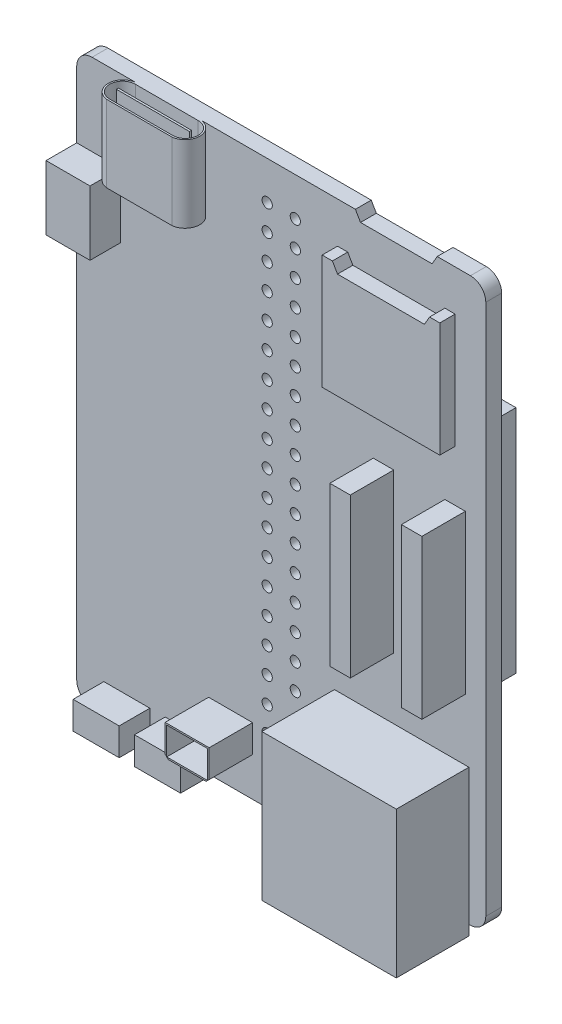
from build123d import *

# Parameters (mm, degrees)
SKETCH1_W            = 55
SKETCH1_H            = 40
BOSS_EXTRUDE1_DEPTH  = 1.55
FILLET1_R            = 1.5
SKETCH2_W            = 13.15
SKETCH2_H            = 14.3
BOSS_EXTRUDE2_DEPTH  = 7.1
SKETCH3_W            = 12.5
SKETCH3_H            = 6.5
SKETCH3_W_2          = 11.1
SKETCH3_H_2          = 1.497681088
CUT_EXTRUDE1_DEPTH   = 13.3
SKETCH4_W            = 8.95
SKETCH4_H            = 7.5
BOSS_EXTRUDE3_DEPTH  = 2.85
CUT_EXTRUDE2_DEPTH   = 7.5
SKETCH5_3_W          = 7.15
SKETCH5_3_H          = 0.2
CUT_EXTRUDE3_DEPTH   = 7
BOSS_EXTRUDE4_DEPTH  = 1.5
CUT_EXTRUDE4_DEPTH   = 10
SKETCH8_W            = 4.5
SKETCH8_H            = 2.7
BOSS_EXTRUDE5_DEPTH  = 3
SKETCH9_R            = 1
BOSS_EXTRUDE6_DEPTH  = 0.5
SKETCH10_W           = 2
SKETCH10_H           = 15.5
BOSS_EXTRUDE7_DEPTH  = 4.25
SKETCH8_4_W          = 4.3
SKETCH8_4_H          = 3
BOSS_EXTRUDE9_DEPTH  = 4.25
SHELL2_T             = -0.15
CHAMFER1_SIZE        = 0.3
SKETCH11_R           = 0.5
CUT_EXTRUDE5_DEPTH   = 1.55
SKETCH12_W           = 4.3
SKETCH12_H           = 6.3
BOSS_EXTRUDE10_DEPTH = 3
SHELL3_T             = -0.2
SKETCH13_W           = 2.9
SKETCH13_H           = 22.5
BOSS_EXTRUDE11_DEPTH = 3


with BuildPart() as part:
    # Sketch1 → Boss-Extrude1 (new body)
    with BuildSketch(Plane(origin=(0, 0, 0), x_dir=(0, 1, 0), z_dir=(0, 0, 1))):
        Rectangle(SKETCH1_W, SKETCH1_H)
    extrude(amount=BOSS_EXTRUDE1_DEPTH)

    # Fillet1
    fillet1_edges = [part.edges().sort_by_distance(p)[0] for p in [
        (20, 27.5, 0.775),
        (20, -27.5, 0.775),
        (-20, -27.5, 0.775),
        (-20, 27.5, 0.775),
    ]]
    fillet(fillet1_edges, radius=FILLET1_R)

    # Sketch2 → Boss-Extrude2 (add)
    with BuildSketch(Plane.XY.offset(1.55)):
        with Locations((11.775, -21.35)):
            Rectangle(SKETCH2_W, SKETCH2_H)
    extrude(amount=BOSS_EXTRUDE2_DEPTH)

    # Sketch3 → Cut-Extrude1 (cut)
    with BuildSketch(Plane.XZ.offset(28.5)):
        with Locations((11.775, 5.1)):
            Rectangle(SKETCH3_W, SKETCH3_H)
        with Locations((11.775, 6.101159456)):
            Rectangle(SKETCH3_W_2, SKETCH3_H_2, mode=Mode.SUBTRACT)
    extrude(amount=-CUT_EXTRUDE1_DEPTH, mode=Mode.SUBTRACT)

    # Sketch4 → Boss-Extrude3 (add)
    with BuildSketch(Plane.XY.offset(1.55)):
        with Locations((-11.025, 23.75)):
            Rectangle(SKETCH4_W, SKETCH4_H)
    extrude(amount=BOSS_EXTRUDE3_DEPTH)

    # Sketch5 → Cut-Extrude2 (cut)
    with BuildSketch(Plane(origin=(0, 27.5, 0), x_dir=(-1, 0, 0), z_dir=(0, 1, 0))):
        with BuildLine():
            Line((6.55, 4.4), (6.55, 2.975))
            ThreePointArc((6.55, 2.975), (6.910359128, 3.926260685), (7.810540583, 4.4))
            Line((7.810540583, 4.4), (6.55, 4.4))
        make_face()
        with BuildLine():
            Line((6.55, 1.55), (7.810540583, 1.55))
            ThreePointArc((7.810540583, 1.55), (6.910359128, 2.023739315), (6.55, 2.975))
            Line((6.55, 2.975), (6.55, 1.55))
        make_face()
        with BuildLine():
            Line((15.5, 1.55), (15.5, 2.975))
            ThreePointArc((15.5, 2.975), (15.139640872, 2.023739315), (14.239459417, 1.55))
            Line((14.239459417, 1.55), (15.5, 1.55))
        make_face()
        with BuildLine():
            Line((15.5, 4.4), (14.239459417, 4.4))
            ThreePointArc((14.239459417, 4.4), (15.139640872, 3.926260685), (15.5, 2.975))
            Line((15.5, 2.975), (15.5, 4.4))
        make_face()
    extrude(amount=-CUT_EXTRUDE2_DEPTH, mode=Mode.SUBTRACT)

    # Sketch5<3> → Cut-Extrude3 (cut)
    with BuildSketch(Plane(origin=(0, 27.5, 0), x_dir=(-1, 0, 0), z_dir=(0, 1, 0))):
        with BuildLine():
            Line((7.95, 1.719461162), (14.1, 1.719461162))
            ThreePointArc((14.1, 1.719461162), (15.355538838, 2.975), (14.1, 4.230538838))
            Line((14.1, 4.230538838), (7.95, 4.230538838))
            ThreePointArc((7.95, 4.230538838), (6.694461162, 2.975), (7.95, 1.719461162))
        make_face()
        with Locations((11.025, 2.975)):
            Rectangle(SKETCH5_3_W, SKETCH5_3_H, mode=Mode.SUBTRACT)
    extrude(amount=-CUT_EXTRUDE3_DEPTH, mode=Mode.SUBTRACT)

    # Sketch6 → Boss-Extrude4 (add)
    with BuildSketch(Plane.XY.offset(1.55)):
        Polygon((16, 23.5), (15.5, 22.633974596), (7, 22.633974596), (6.5, 23.5), (5.5, 23.5), (5.5, 12.3), (17, 12.3), (17, 23.5), align=None)
    extrude(amount=BOSS_EXTRUDE4_DEPTH)

    # Sketch7 → Cut-Extrude4 (cut)
    with BuildSketch(Plane.XY.offset(1.55)):
        Polygon((7.25, 27.5), (7.75, 26.633974596), (14.75, 26.633974596), (15.25, 27.5), align=None)
    extrude(amount=-CUT_EXTRUDE4_DEPTH, mode=Mode.SUBTRACT)

    # Sketch8 → Boss-Extrude5 (add)
    with BuildSketch(Plane.XY.offset(1.55)):
        with Locations((-9.1, -26.15)):
            Rectangle(SKETCH8_W, SKETCH8_H)
        with Locations((-15.1, -26.15)):
            Rectangle(SKETCH8_W, SKETCH8_H)
    extrude(amount=BOSS_EXTRUDE5_DEPTH)

    # Sketch9 → Boss-Extrude6 (add)
    with BuildSketch(Plane.XZ.offset(27.5)):
        with Locations(Location((-9.1, 3.05, 0), (0, 0, 270))):
            Circle(SKETCH9_R)
        with Locations(Location((-15.1, 3.05, 0), (0, 0, 90))):
            Circle(SKETCH9_R)
    extrude(amount=BOSS_EXTRUDE6_DEPTH)

    # Sketch10 → Boss-Extrude7 (add)
    with BuildSketch(Plane.XY.offset(1.55)):
        with Locations((17, -0.45)):
            Rectangle(SKETCH10_W, SKETCH10_H)
        with Locations((10, -0.45)):
            Rectangle(SKETCH10_W, SKETCH10_H)
    extrude(amount=BOSS_EXTRUDE7_DEPTH)


with BuildPart() as body_2:
    # Sketch8<4> → Boss-Extrude9 (new body)
    with BuildSketch(Plane.XY.offset(1.55)):
        with Locations((-4.95, -22.5)):
            Rectangle(SKETCH8_4_W, SKETCH8_4_H)
    extrude(amount=BOSS_EXTRUDE9_DEPTH)

    # Shell2
    shell2_openings = [body_2.faces().sort_by_distance(p)[0] for p in [
        (-4.95, -22.5, 5.8),
    ]]
    offset(amount=SHELL2_T, openings=shell2_openings, kind=Kind.INTERSECTION)


with BuildPart() as part_1:
    add(part.part)

    # Combine1: union body 2
    add(body_2.part)

    # Chamfer1
    chamfer1_edges = [part_1.edges().sort_by_distance(p)[0] for p in [
        (-2.8, -24, 3.675),
        (-7.1, -24, 3.675),
    ]]
    chamfer(chamfer1_edges, length=CHAMFER1_SIZE - 0.0001)  # a hair under: the kernel refuses the full size

    # Sketch11 → Cut-Extrude5 (cut)
    with BuildSketch(Plane.XY.offset(1.55)):
        with Locations((1.375, 23.75)):
            Circle(SKETCH11_R)
        with Locations((1.375, 21.25)):
            Circle(SKETCH11_R)
        with Locations((1.375, 18.75)):
            Circle(SKETCH11_R)
        with Locations((1.375, 16.25)):
            Circle(SKETCH11_R)
        with Locations((1.375, 13.75)):
            Circle(SKETCH11_R)
        with Locations((1.375, 11.25)):
            Circle(SKETCH11_R)
        with Locations((1.375, 8.75)):
            Circle(SKETCH11_R)
        with Locations((1.375, 6.25)):
            Circle(SKETCH11_R)
        with Locations((1.375, 3.75)):
            Circle(SKETCH11_R)
        with Locations((1.375, 1.25)):
            Circle(SKETCH11_R)
        with Locations((1.375, -1.25)):
            Circle(SKETCH11_R)
        with Locations((1.375, -3.75)):
            Circle(SKETCH11_R)
        with Locations((1.375, -6.25)):
            Circle(SKETCH11_R)
        with Locations((1.375, -8.75)):
            Circle(SKETCH11_R)
        with Locations((1.375, -11.25)):
            Circle(SKETCH11_R)
        with Locations((1.375, -13.75)):
            Circle(SKETCH11_R)
        with Locations((1.375, -16.25)):
            Circle(SKETCH11_R)
        with Locations((1.375, -18.75)):
            Circle(SKETCH11_R)
        with Locations((1.375, -21.25)):
            Circle(SKETCH11_R)
        with Locations((1.375, -23.75)):
            Circle(SKETCH11_R)
        with Locations(Location((-1.375, -23.75, 0), (0, 0, 180))):
            Circle(SKETCH11_R)
        with Locations(Location((-1.375, -21.25, 0), (0, 0, 180))):
            Circle(SKETCH11_R)
        with Locations(Location((-1.375, -18.75, 0), (0, 0, 180))):
            Circle(SKETCH11_R)
        with Locations(Location((-1.375, -16.25, 0), (0, 0, 180))):
            Circle(SKETCH11_R)
        with Locations(Location((-1.375, -13.75, 0), (0, 0, 180))):
            Circle(SKETCH11_R)
        with Locations(Location((-1.375, -11.25, 0), (0, 0, 180))):
            Circle(SKETCH11_R)
        with Locations(Location((-1.375, -8.75, 0), (0, 0, 180))):
            Circle(SKETCH11_R)
        with Locations(Location((-1.375, -6.25, 0), (0, 0, 180))):
            Circle(SKETCH11_R)
        with Locations(Location((-1.375, -3.75, 0), (0, 0, 180))):
            Circle(SKETCH11_R)
        with Locations(Location((-1.375, -1.25, 0), (0, 0, 180))):
            Circle(SKETCH11_R)
        with Locations(Location((-1.375, 1.25, 0), (0, 0, 180))):
            Circle(SKETCH11_R)
        with Locations(Location((-1.375, 3.75, 0), (0, 0, 180))):
            Circle(SKETCH11_R)
        with Locations(Location((-1.375, 6.25, 0), (0, 0, 180))):
            Circle(SKETCH11_R)
        with Locations(Location((-1.375, 8.75, 0), (0, 0, 180))):
            Circle(SKETCH11_R)
        with Locations(Location((-1.375, 11.25, 0), (0, 0, 180))):
            Circle(SKETCH11_R)
        with Locations(Location((-1.375, 13.75, 0), (0, 0, 180))):
            Circle(SKETCH11_R)
        with Locations(Location((-1.375, 16.25, 0), (0, 0, 180))):
            Circle(SKETCH11_R)
        with Locations(Location((-1.375, 18.75, 0), (0, 0, 180))):
            Circle(SKETCH11_R)
        with Locations(Location((-1.375, 23.75, 0), (0, 0, 180))):
            Circle(SKETCH11_R)
        with Locations(Location((-1.375, 21.25, 0), (0, 0, 180))):
            Circle(SKETCH11_R)
    extrude(amount=-CUT_EXTRUDE5_DEPTH, mode=Mode.SUBTRACT)

    # Sketch13 → Boss-Extrude11 (add)
    with BuildSketch(Plane(origin=(0, 0, 0), x_dir=(1, 0, 0), z_dir=(0, 0, -1))):
        with Locations((16.95, -2.75)):
            Rectangle(SKETCH13_W, SKETCH13_H)
        with Locations((-16.95, -2.75)):
            Rectangle(SKETCH13_W, SKETCH13_H)
    extrude(amount=BOSS_EXTRUDE11_DEPTH)


with BuildPart() as body_2_2:
    # Sketch12 → Boss-Extrude10 (new body)
    with BuildSketch(Plane.XY.offset(1.55)):
        with Locations((-17.85, 16.35)):
            Rectangle(SKETCH12_W, SKETCH12_H)
    extrude(amount=BOSS_EXTRUDE10_DEPTH)

    # Shell3
    shell3_openings = [body_2_2.faces().sort_by_distance(p)[0] for p in [
        (-20, 16.35, 3.05),
    ]]
    offset(amount=SHELL3_T, openings=shell3_openings, kind=Kind.INTERSECTION)


solid = Compound([part_1.part, body_2_2.part])
